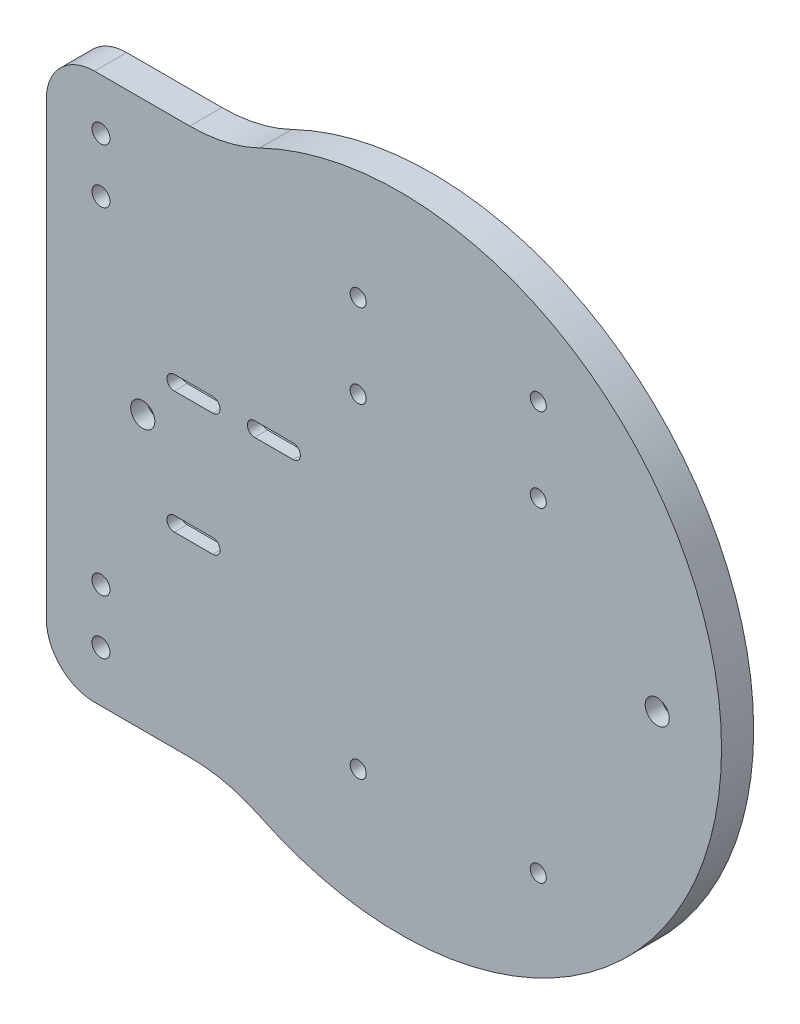
from build123d import *

# Parameters (mm, degrees)
SALIENTE_EXTRUIR2_DEPTH                              = 10
REDONDEO3_R                                          = 15
REDONDEO5_R                                          = 50
CROQUIS4_R                                           = 2.8
CROQUIS4_R_2                                         = 2.5
CORTAR_EXTRUIR1_DEPTH                                = 149.996644258
REFRENTADO_PARA_TORNILLO_CON_CABEZA_TRON_D           = 4.5
REFRENTADO_PARA_TORNILLO_CON_CABEZA_TRON_CBORE_D     = 7.5
REFRENTADO_PARA_TORNILLO_CON_CABEZA_TRON_CBORE_DEPTH = 5
CORTAR_EXTRUIR2_DEPTH                                = 6


with BuildPart() as part:
    # Croquis2 → Saliente-Extruir2 (new body)
    with BuildSketch(Plane(origin=(0, 0, 0), x_dir=(0, 1, 0), z_dir=(0, 0, 1))):
        with BuildLine():
            Line((-85, 52.678268764), (-85, 110))
            Line((-85, 110), (85, 110))
            Line((85, 110), (85, 52.678268764))
            ThreePointArc((85, 52.678268764), (0, -100), (-85, 52.678268764))
        make_face()
    extrude(amount=SALIENTE_EXTRUIR2_DEPTH)

    # Redondeo3
    redondeo3_edges = [part.edges().sort_by_distance(p)[0] for p in [
        (-110, 85, 5),
        (-110, -85, 5),
    ]]
    fillet(redondeo3_edges, radius=REDONDEO3_R)

    # Redondeo5
    redondeo5_edges = [part.edges().sort_by_distance(p)[0] for p in [
        (-52.678268764, 85, 5),
        (-52.678268764, -85, 5),
    ]]
    fillet(redondeo5_edges, radius=REDONDEO5_R)

    # Croquis4 → Cortar-Extruir1 (cut, through all)
    with BuildSketch(Plane.XY.offset(10)):
        with Locations((-93, 69.200000001)):
            Circle(CROQUIS4_R)
        with Locations((-93, 52.279001068)):
            Circle(CROQUIS4_R)
        with Locations((-93, -52.279001068)):
            Circle(CROQUIS4_R)
        with Locations((-93, -69.199999999)):
            Circle(CROQUIS4_R)
        with Locations((-13, 39.000000001)):
            Circle(CROQUIS4_R_2)
        with Locations((43, 39)):
            Circle(CROQUIS4_R_2)
        with Locations((-13, 65)):
            Circle(CROQUIS4_R_2)
        with Locations((43, 65.000000001)):
            Circle(CROQUIS4_R_2)
        with Locations((-13, -62)):
            Circle(CROQUIS4_R_2)
        with Locations((43, -62)):
            Circle(CROQUIS4_R_2)
        with BuildLine():
            Line((-58.219532094, 11.25), (-70.219532094, 11.25))
            ThreePointArc((-70.219532094, 11.25), (-72.469532094, 13.5), (-70.219532094, 15.75))
            Line((-70.219532094, 15.75), (-58.219532094, 15.75))
            ThreePointArc((-58.219532094, 15.75), (-55.969532094, 13.5), (-58.219532094, 11.25))
        make_face()
        with BuildLine():
            Line((-33.219532094, 11.25), (-45.219532094, 11.25))
            ThreePointArc((-45.219532094, 11.25), (-47.469532094, 13.5), (-45.219532094, 15.75))
            Line((-45.219532094, 15.75), (-33.219532094, 15.75))
            ThreePointArc((-33.219532094, 15.75), (-30.969532094, 13.5), (-33.219532094, 11.25))
        make_face()
        with BuildLine():
            Line((-58.219532094, -26.75), (-70.219532094, -26.75))
            ThreePointArc((-70.219532094, -26.75), (-72.469532094, -24.5), (-70.219532094, -22.25))
            Line((-70.219532094, -22.25), (-58.219532094, -22.25))
            ThreePointArc((-58.219532094, -22.25), (-55.969532094, -24.5), (-58.219532094, -26.75))
        make_face()
    extrude(amount=-CORTAR_EXTRUIR1_DEPTH, mode=Mode.SUBTRACT)

    # Refrentado para tornillo con cabeza troncocónica de M41 (through all)
    with Locations(Plane.XY.offset(10)):
        with Locations((-80, 0), (80, 0)):
            CounterBoreHole(REFRENTADO_PARA_TORNILLO_CON_CABEZA_TRON_D / 2, REFRENTADO_PARA_TORNILLO_CON_CABEZA_TRON_CBORE_D / 2, REFRENTADO_PARA_TORNILLO_CON_CABEZA_TRON_CBORE_DEPTH)

    # Croquis7 → Cortar-Extruir2 (cut)
    with BuildSketch(Plane(origin=(0, 0, 0), x_dir=(1, 0, 0), z_dir=(0, 0, -1))):
        with BuildLine():
            Line((-70.219532094, 29), (-58.219532094, 29))
            ThreePointArc((-58.219532094, 29), (-53.719532094, 24.5), (-58.219532094, 20))
            Line((-58.219532094, 20), (-70.219532094, 20))
            ThreePointArc((-70.219532094, 20), (-74.719532094, 24.5), (-70.219532094, 29))
        make_face()
        with BuildLine():
            Line((-70.219532094, -9), (-58.219532094, -9))
            ThreePointArc((-58.219532094, -9), (-53.719532094, -13.5), (-58.219532094, -18))
            Line((-58.219532094, -18), (-70.219532094, -18))
            ThreePointArc((-70.219532094, -18), (-74.719532094, -13.5), (-70.219532094, -9))
        make_face()
        with BuildLine():
            Line((-45.219532094, -9), (-33.219532094, -9))
            ThreePointArc((-33.219532094, -9), (-28.719532094, -13.5), (-33.219532094, -18))
            Line((-33.219532094, -18), (-45.219532094, -18))
            ThreePointArc((-45.219532094, -18), (-49.719532094, -13.5), (-45.219532094, -9))
        make_face()
    extrude(amount=-CORTAR_EXTRUIR2_DEPTH, mode=Mode.SUBTRACT)


solid = part.part
